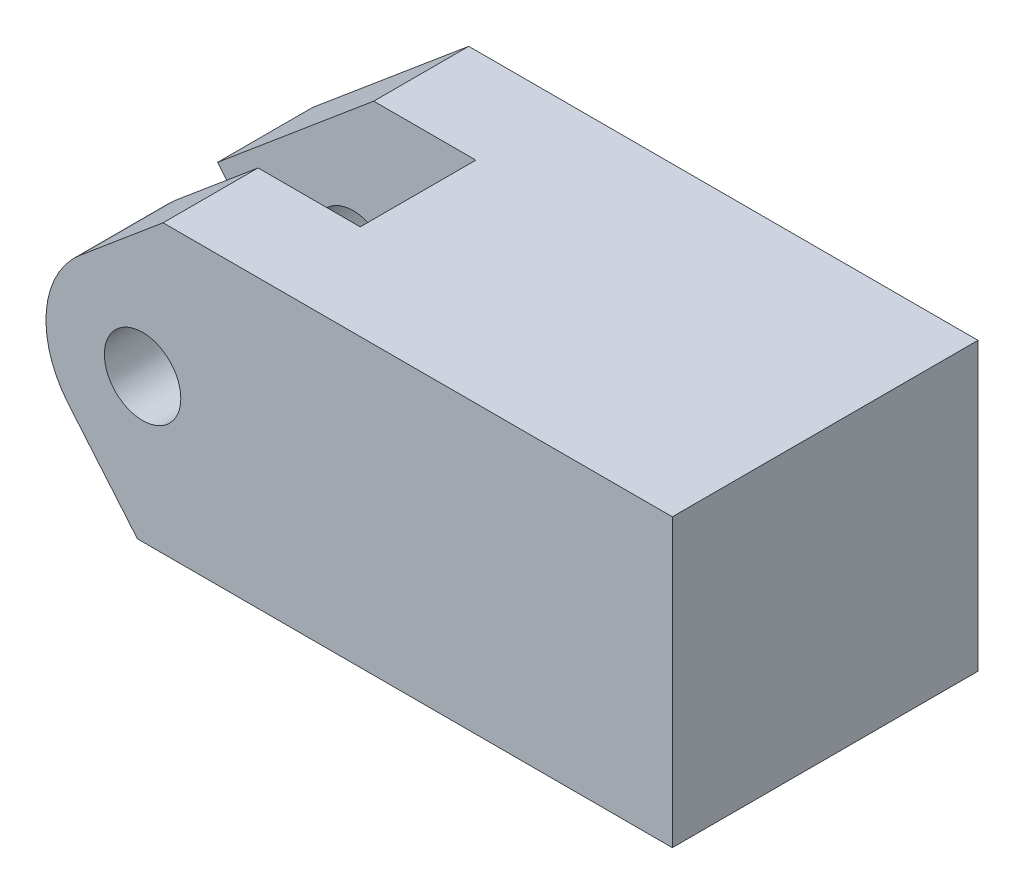
from build123d import *

# Parameters (mm, degrees)
SKETCH_1_W          = 35
SKETCH_1_H          = 16
EXTRUDE_1_DEPTH     = 15
SKETCH_2_W          = 27.377038818
SKETCH_2_H          = 6.053774878
CUT_EXTRUDE_2_DEPTH = 25.397745798
SKETCH_3_R          = 2
CUT_EXTRUDE_3_DEPTH = 29.057975693
CHAMFER_1_SIZE      = 8.342275148
CHAMFER_1_SIZE_2    = 7
FILLET_1_R          = 5


with BuildPart() as part:
    # Эскиз1 → Вытянуть1 (new body)
    with BuildSketch(Plane(origin=(0, 0, 0), x_dir=(1, 0, 0), z_dir=(0, 1, 0))):
        Rectangle(SKETCH_1_W, SKETCH_1_H)
    extrude(amount=EXTRUDE_1_DEPTH)

    # Эскиз2 → Вытянуть2 (cut, through all)
    with BuildSketch(Plane(origin=(0, 15, 0), x_dir=(1, 0, 0), z_dir=(0, 1, 0))):
        with Locations((-17.5, 0)):
            Rectangle(SKETCH_2_W, SKETCH_2_H)
    extrude(amount=-CUT_EXTRUDE_2_DEPTH, mode=Mode.SUBTRACT)

    # Эскиз3 → Вытянуть3 (cut, through all)
    with BuildSketch(Plane.XY.offset(8)):
        with Locations((-10.229823295, 7.5)):
            Circle(SKETCH_3_R)
    extrude(amount=-CUT_EXTRUDE_3_DEPTH, mode=Mode.SUBTRACT)

    # Фаска1
    # the kernel refuses this chamfer: 8.342275148, 7 mm, written as the material it takes off along each edge
    with BuildSketch(Plane(origin=(-17.5, 0, 18.474543444), x_dir=(-0.024939322090234327, 0.9996889667359942, 0), z_dir=(0, 0, -1)), Plane(origin=(-17.5, 15, 29.501430883), x_dir=(0.9996889667359942, 0.024939322090234327, 0), z_dir=(0, 0, -1))) as chamfer_1_piece_1:
        Polygon((CHAMFER_1_SIZE * 0.999688966755, CHAMFER_1_SIZE * 0.0249393220907), (-CHAMFER_1_SIZE_2 * 0.0249393220902, CHAMFER_1_SIZE_2 * 0.999688966736), (0, 0), align=None)
    extrude(amount=47.975974327, mode=Mode.SUBTRACT)
    with BuildSketch(Plane(origin=(-17.5, 0, 29.501430883), x_dir=(0.9993728857116146, -0.03540953691366304, 0), z_dir=(0, 0, -1)), Plane(origin=(-17.5, 15, 18.474543444), x_dir=(-0.035409536913663095, -0.9993728857116146, 0), z_dir=(0, 0, -1))) as chamfer_1_piece_2:
        Polygon((CHAMFER_1_SIZE_2 * 0.999372885712, -CHAMFER_1_SIZE_2 * 0.0354095369137), (-CHAMFER_1_SIZE * 0.0354095369143, -CHAMFER_1_SIZE * 0.999372885731), (0, 0), align=None)
    extrude(amount=47.975974327, mode=Mode.SUBTRACT)

    # Скругление1
    fillet_1_edges = [part.edges().sort_by_distance(p)[0] for p in [
        (-17.33146239, 8.141419846, 5.513443719),
    ]]
    fillet(fillet_1_edges, radius=FILLET_1_R)


solid = part.part
